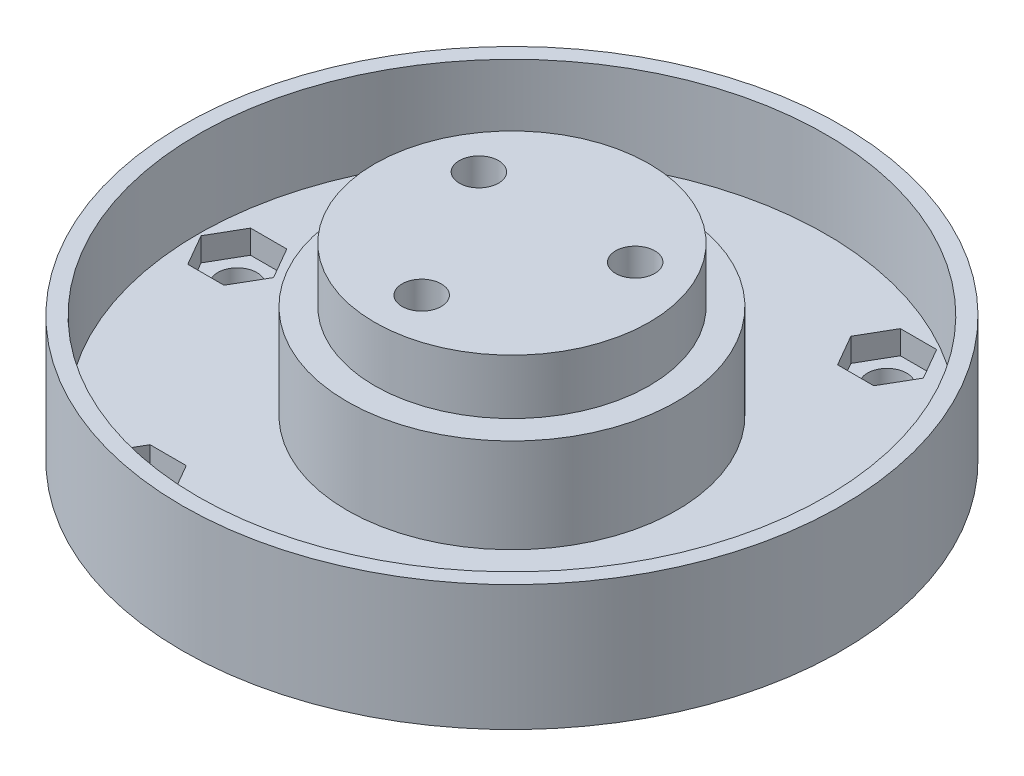
from build123d import *

# Parameters (mm, degrees)
SKETCH1_R           = 17.5
SKETCH1_R_2         = 2.5
BOSS_EXTRUDE1_DEPTH = 24
SKETCH1_3_R         = 21
SKETCH1_3_R_2       = 17.5
BOSS_EXTRUDE2_DEPTH = 17
SKETCH1_6_R         = 40
SKETCH1_6_R_2       = 21
BOSS_EXTRUDE4_DEPTH = 5
SKETCH1_7_R         = 42
SKETCH1_7_R_2       = 40
BOSS_EXTRUDE5_DEPTH = 16
SKETCH2_R           = 2.5
CUT_EXTRUDE1_DEPTH  = 63.361847311
CUT_EXTRUDE2_DEPTH  = 3


with BuildPart() as part:
    # Sketch1 → Boss-Extrude1 (new body)
    with BuildSketch(Plane(origin=(0, 0, 0), x_dir=(1, 0, 0), z_dir=(0, 1, 0))):
        Circle(SKETCH1_R)
        with Locations((0, -11.5)):
            Circle(SKETCH1_R_2, mode=Mode.SUBTRACT)
        with Locations((-9.959292144, 5.75)):
            Circle(SKETCH1_R_2, mode=Mode.SUBTRACT)
        with Locations((9.959292144, 5.75)):
            Circle(SKETCH1_R_2, mode=Mode.SUBTRACT)
    extrude(amount=BOSS_EXTRUDE1_DEPTH)

    # Sketch1<3> → Boss-Extrude2 (add)
    with BuildSketch(Plane(origin=(0, 0, 0), x_dir=(1, 0, 0), z_dir=(0, 1, 0))):
        Circle(SKETCH1_3_R)
        Circle(SKETCH1_3_R_2, mode=Mode.SUBTRACT)
    extrude(amount=BOSS_EXTRUDE2_DEPTH)

    # Sketch1<6> → Boss-Extrude4 (add)
    with BuildSketch(Plane(origin=(0, 0, 0), x_dir=(1, 0, 0), z_dir=(0, 1, 0))):
        Circle(SKETCH1_6_R)
        Circle(SKETCH1_6_R_2, mode=Mode.SUBTRACT)
    extrude(amount=BOSS_EXTRUDE4_DEPTH)

    # Sketch1<7> → Boss-Extrude5 (add)
    with BuildSketch(Plane(origin=(0, 0, 0), x_dir=(1, 0, 0), z_dir=(0, 1, 0))):
        Circle(SKETCH1_7_R)
        Circle(SKETCH1_7_R_2, mode=Mode.SUBTRACT)
    extrude(amount=BOSS_EXTRUDE5_DEPTH)

    # Sketch2 → Cut-Extrude1 (cut, through all)
    with BuildSketch(Plane(origin=(0, 5, 0), x_dir=(1, 0, 0), z_dir=(0, 1, 0))):
        with Locations((-35, 0)):
            Circle(SKETCH2_R)
        with Locations((-17.5, 30.310889132)):
            Circle(SKETCH2_R)
        with Locations((17.5, 30.310889132)):
            Circle(SKETCH2_R)
        with Locations((35, 0)):
            Circle(SKETCH2_R)
        with Locations((17.5, -30.310889132)):
            Circle(SKETCH2_R)
        with Locations((-17.5, -30.310889132)):
            Circle(SKETCH2_R)
    extrude(amount=-CUT_EXTRUDE1_DEPTH, mode=Mode.SUBTRACT)

    # Sketch3 → Cut-Extrude2 (cut)
    with BuildSketch(Plane(origin=(0, 5, 0), x_dir=(1, 0, 0), z_dir=(0, 1, 0))):
        Polygon((-12.881197846, 30.310889132), (-15.190598923, 34.310889132), (-19.809401077, 34.310889132), (-22.118802154, 30.310889132), (-19.809401077, 26.310889132), (-15.190598923, 26.310889132), align=None)
        Polygon((19.809401077, 26.310889132), (22.118802154, 30.310889132), (19.809401077, 34.310889132), (15.190598923, 34.310889132), (12.881197846, 30.310889132), (15.190598923, 26.310889132), align=None)
        Polygon((32.690598923, -4), (37.309401077, -4), (39.618802154, 0), (37.309401077, 4), (32.690598923, 4), (30.381197846, 0), align=None)
        Polygon((12.881197846, -30.310889132), (15.190598923, -34.310889132), (19.809401077, -34.310889132), (22.118802154, -30.310889132), (19.809401077, -26.310889132), (15.190598923, -26.310889132), align=None)
        Polygon((-19.809401077, -26.310889132), (-22.118802154, -30.310889132), (-19.809401077, -34.310889132), (-15.190598923, -34.310889132), (-12.881197846, -30.310889132), (-15.190598923, -26.310889132), align=None)
        Polygon((-32.690598923, 4), (-37.309401077, 4), (-39.618802154, 0), (-37.309401077, -4), (-32.690598923, -4), (-30.381197846, 0), align=None)
    extrude(amount=-CUT_EXTRUDE2_DEPTH, mode=Mode.SUBTRACT)


solid = part.part
